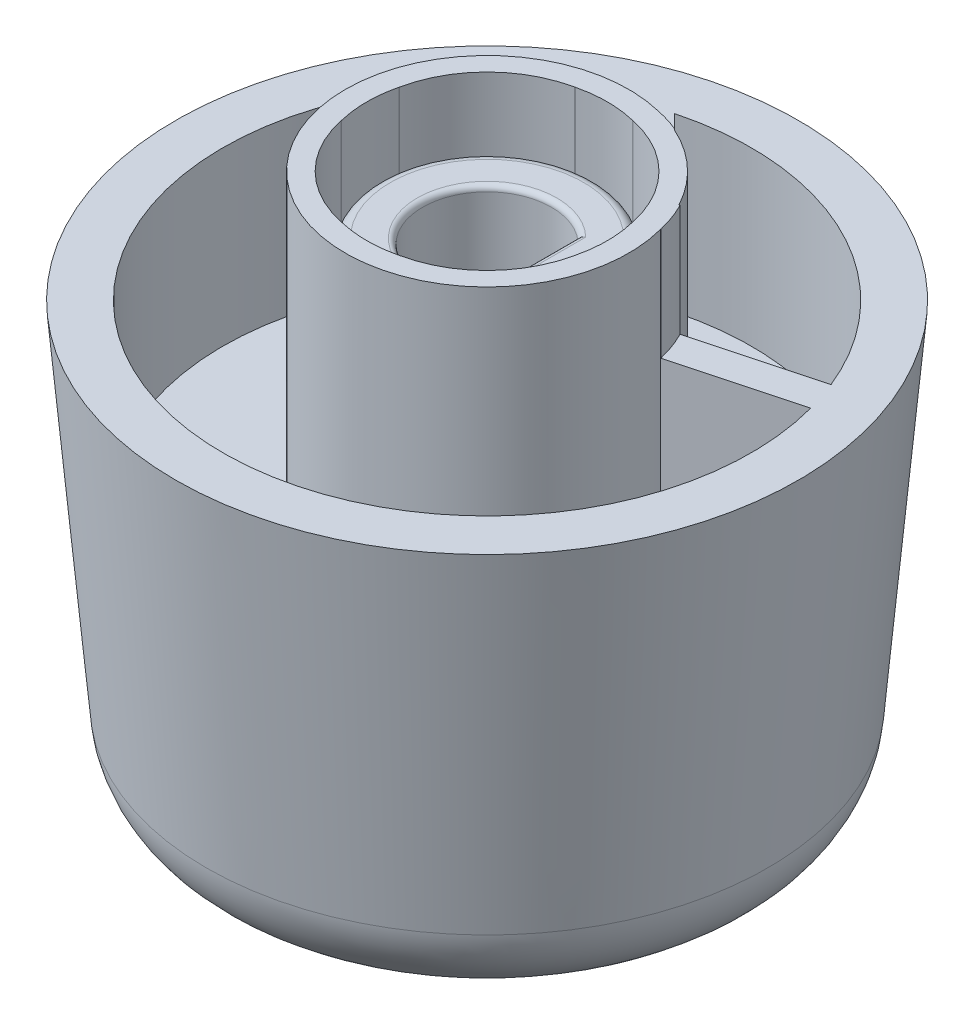
from build123d import *
from build123d.topology import SkipClean

# Parameters (mm, degrees)
SKETCH1_R             = 5
BOSS_EXTRUDE1_DEPTH   = 2.5
BOSS_EXTRUDE2_DEPTH   = 5.2
BOSS_EXTRUDE2_2_DEPTH = 5.2
BOSS_EXTRUDE2_3_DEPTH = 5.2
BOSS_EXTRUDE2_4_DEPTH = 5.2
FILLET1_R             = 0.5
FILLET2_R             = 0.5
FILLET3_R             = 0.5
FILLET4_R             = 0.5
SKETCH3_R             = 14.5
BOSS_EXTRUDE3_DEPTH   = 20
SKETCH4_OUTSIDE_W     = 44.126
SKETCH4_OUTSIDE_H     = 44.126
SKETCH4_OUTSIDE_R     = 14.5
CUT_EXTRUDE2_DEPTH    = 20
CUT_EXTRUDE2_DRAFT    = 5
FILLET5_R             = 4
CUT_EXTRUDE3_START    = -14
CUT_EXTRUDE3_DEPTH    = 14
FILLET6_R             = 0.25
FILLET7_R             = 0.5
CUT_EXTRUDE4_START    = -8
SKETCH6_R             = 12.3
SKETCH6_R_2           = 6.6
CUT_EXTRUDE4_DEPTH    = 8
BOSS_EXTRUDE4_DEPTH   = 8
BOSS_EXTRUDE5_DEPTH   = 5.2


# Read off the part's stored shape, not the designer's step: Boss-Extrude5
with BuildPart() as part:
    # Sketch1 → Boss-Extrude1 (new body)
    with BuildSketch(Plane(origin=(0, 0, 0), x_dir=(1, 0, 0), z_dir=(0, 1, 0))):
        with Locations(Location((0, 0, 0), (0, 0, 270))):
            Circle(SKETCH1_R)
        with BuildLine():
            Line((2, 2.236067977), (2, -2.236067977))
            ThreePointArc((2, -2.236067977), (-3, 0), (2, 2.236067977))
        make_face(mode=Mode.SUBTRACT)
    extrude(amount=BOSS_EXTRUDE1_DEPTH)



with BuildPart() as body_2:
    # Sketch2 → Boss-Extrude2 (new body)
    with BuildSketch(Plane.XZ):
        with BuildLine():
            Line((-6.305354867, 1.95), (-5.249523788, 1.95))
            ThreePointArc((-5.249523788, 1.95), (-5.6, 0), (-5.249523788, -1.95))
            Line((-5.249523788, -1.95), (-6.305354867, -1.95))
            ThreePointArc((-6.305354867, -1.95), (-6.6, 0), (-6.305354867, 1.95))
        make_face()
    extrude(amount=-BOSS_EXTRUDE2_DEPTH)

    # Fillet4
    fillet4_edges = [body_2.edges().sort_by_distance(p)[0] for p in [
        (-6.305354867, 2.6, 1.95),
        (-5.249523788, 2.6, -1.95),
        (-6.305354867, 2.6, -1.95),
        (-5.249523788, 2.6, 1.95),
    ]]
    fillet(fillet4_edges, radius=FILLET4_R - 0.0001)  # a hair under: the kernel refuses the full size


with BuildPart() as body_3:
    # Sketch2 → Boss-Extrude2 2 (new body)
    with BuildSketch(Plane.XZ):
        with BuildLine():
            Line((-1.95, 6.305354867), (-1.95, 5.249523788))
            ThreePointArc((-1.95, 5.249523788), (0, 5.6), (1.95, 5.249523788))
            Line((1.95, 5.249523788), (1.95, 6.305354867))
            ThreePointArc((1.95, 6.305354867), (0, 6.6), (-1.95, 6.305354867))
        make_face()
    extrude(amount=-BOSS_EXTRUDE2_2_DEPTH)

    # Fillet3
    fillet3_edges = [body_3.edges().sort_by_distance(p)[0] for p in [
        (-1.95, 2.6, 6.305354867),
        (-1.95, 2.6, 5.249523788),
        (1.95, 2.6, 6.305354867),
        (1.95, 2.6, 5.249523788),
    ]]
    fillet(fillet3_edges, radius=FILLET3_R - 0.0001)  # a hair under: the kernel refuses the full size


with BuildPart() as body_4:
    # Sketch2 → Boss-Extrude2 3 (new body)
    with BuildSketch(Plane.XZ):
        with BuildLine():
            Line((6.305354867, 1.95), (5.249523788, 1.95))
            ThreePointArc((5.249523788, 1.95), (5.6, 0), (5.249523788, -1.95))
            Line((5.249523788, -1.95), (6.305354867, -1.95))
            ThreePointArc((6.305354867, -1.95), (6.6, 0), (6.305354867, 1.95))
        make_face()
    extrude(amount=-BOSS_EXTRUDE2_3_DEPTH)

    # Fillet2
    fillet2_edges = [body_4.edges().sort_by_distance(p)[0] for p in [
        (6.305354867, 2.6, 1.95),
        (6.305354867, 2.6, -1.95),
        (5.249523788, 2.6, -1.95),
        (5.249523788, 2.6, 1.95),
    ]]
    fillet(fillet2_edges, radius=FILLET2_R - 0.0001)  # a hair under: the kernel refuses the full size


with BuildPart() as body_5:
    # Sketch2 → Boss-Extrude2 4 (new body)
    with BuildSketch(Plane.XZ):
        with BuildLine():
            Line((1.95, -6.305354867), (1.95, -5.249523788))
            ThreePointArc((1.95, -5.249523788), (0, -5.6), (-1.95, -5.249523788))
            Line((-1.95, -5.249523788), (-1.95, -6.305354867))
            ThreePointArc((-1.95, -6.305354867), (0, -6.6), (1.95, -6.305354867))
        make_face()
    extrude(amount=-BOSS_EXTRUDE2_4_DEPTH)

    # Fillet1
    fillet1_edges = [body_5.edges().sort_by_distance(p)[0] for p in [
        (1.95, 2.6, -6.305354867),
        (-1.95, 2.6, -6.305354867),
        (1.95, 2.6, -5.249523788),
        (-1.95, 2.6, -5.249523788),
    ]]
    fillet(fillet1_edges, radius=FILLET1_R - 0.0001)  # a hair under: the kernel refuses the full size


with BuildPart() as part_1:
    add(part.part)

    add(body_2.part)  # Boss-Extrude3 merges body 2

    add(body_3.part)  # Boss-Extrude3 merges body 3

    add(body_4.part)  # Boss-Extrude3 merges body 4

    add(body_5.part)  # Boss-Extrude3 merges body 5
    # Sketch3 → Boss-Extrude3 (add)
    with BuildSketch(Plane(origin=(0, 0, 0), x_dir=(1, 0, 0), z_dir=(0, 1, 0))):
        with Locations(Location((0, 0, 0), (0, 0, 270))):
            Circle(SKETCH3_R)
    extrude(amount=-BOSS_EXTRUDE3_DEPTH)


with BuildPart() as cut_extrude2_tool:
    # Sketch4 outside → Cut-Extrude2 (with draft: the straight prism first)
    with BuildSketch(Plane(origin=(0, 0, 0), x_dir=(1, 0, 0), z_dir=(0, 1, 0))):
        Rectangle(SKETCH4_OUTSIDE_W, SKETCH4_OUTSIDE_H)
        Circle(SKETCH4_OUTSIDE_R, mode=Mode.SUBTRACT)
    extrude(amount=-CUT_EXTRUDE2_DEPTH)
    # Cut-Extrude2: the draft: its side faces are tilted about the plane it starts from
    cut_extrude2_sides = [cut_extrude2_tool.faces().sort_by_distance(p)[0] for p in [
        (0, -10, 22.063),
        (22.063, -10, 0),
        (0, -10, -22.063),
        (-22.063, -10, 0),
        (-14.5, -10, 0),
    ]]
    draft(cut_extrude2_sides, Plane(origin=(0, 0, 0), x_dir=(1, 0, 0), z_dir=(0, 1, 0)), CUT_EXTRUDE2_DRAFT)


with BuildPart() as part_2:
    add(part_1.part)

    # Cut-Extrude2: cut by cut_extrude2_tool
    add(cut_extrude2_tool.part, mode=Mode.SUBTRACT)

    # Fillet5
    fillet5_edges = [part_2.edges().sort_by_distance(p)[0] for p in [
        (-12.750226729, -20, 0),
    ]]
    fillet(fillet5_edges, radius=FILLET5_R)

    # Sketch5 → Cut-Extrude3 (cut)
    with SkipClean():  # the faces are left unmerged after this step: merging them gives an invalid solid
        with BuildSketch(Plane(origin=(0, 0, 0), x_dir=(1, 0, 0), z_dir=(0, 1, 0)).offset(CUT_EXTRUDE3_START)):
            with BuildLine():
                Line((2, -2.236067977), (2, 2.236067977))
                ThreePointArc((2, 2.236067977), (-3, 0), (2, -2.236067977))
            make_face()
        extrude(amount=CUT_EXTRUDE3_DEPTH, mode=Mode.SUBTRACT)

    # Fillet6
    fillet6_edges = [part_2.edges().sort_by_distance(p)[0] for p in [
        (-3, 2.5, 0),
        (2, 2.5, 0),
    ]]
    fillet(fillet6_edges, radius=FILLET6_R)

    # Fillet7
    fillet7_edges = [part_2.edges().sort_by_distance(p)[0] for p in [
        (0, 2.5, -5),
    ]]
    fillet(fillet7_edges, radius=FILLET7_R)

    # Sketch6 → Cut-Extrude4 (cut)
    with SkipClean():  # the faces are left unmerged after this step: merging them gives an invalid solid
        with BuildSketch(Plane(origin=(0, 0, 0), x_dir=(1, 0, 0), z_dir=(0, 1, 0)).offset(CUT_EXTRUDE4_START)):
            with Locations(Location((0, 0, 0), (0, 0, 270))):
                Circle(SKETCH6_R)
            with Locations(Location((0, 0, 0), (0, 0, 76.248877743))):
                Circle(SKETCH6_R_2, mode=Mode.SUBTRACT)
        extrude(amount=CUT_EXTRUDE4_DEPTH, mode=Mode.SUBTRACT)

    # Sketch7 → Boss-Extrude4 (add)
    with SkipClean():  # the faces are left unmerged after this step: merging them gives an invalid solid
        with BuildSketch(Plane(origin=(0, -8, 0), x_dir=(1, 0, 0), z_dir=(0, 1, 0))):
            with BuildLine():
                Line((6.375110454, 1.708205698), (11.880887663, 3.183474255))
                ThreePointArc((11.880887663, 3.183474255), (11.664219973, 3.903328376), (11.40398128, 4.608601845))
                Line((11.40398128, 4.608601845), (5.820052572, 3.112392657))
                ThreePointArc((5.820052572, 3.112392657), (6.137868976, 2.426224317), (6.375110454, 1.708205698))
            make_face()
            with BuildLine():
                Line((2.697938648, 6.023381696), (-3.164606791, 11.885927135))
                ThreePointArc((-3.164606791, 11.885927135), (-3.964993354, 11.643402754), (-4.747049149, 11.347049149))
                Line((-4.747049149, 11.347049149), (0, 6.6))
                ThreePointArc((0, 6.6), (1.379434813, 6.454235787), (2.697938648, 6.023381696))
            make_face()
        extrude(amount=BOSS_EXTRUDE4_DEPTH)

    # Boss-Extrude5 outline → Boss-Extrude5 (add)
    with SkipClean():  # the faces are left unmerged after this step: merging them gives an invalid solid
        with BuildSketch(Plane(origin=(0, 0, 0), x_dir=(1, 0, 0), z_dir=(0, 1, 0))):
            with BuildLine():
                ThreePointArc((5.820052572, 3.112392657), (4.500834134, 4.827265489), (2.697938648, 6.023381696))
                Line((2.697938648, 6.023381696), (2.63830786, 6.083012483))
                ThreePointArc((2.63830786, 6.083012483), (2.110900212, 6.270800504), (1.568852459, 6.410826933))
                ThreePointArc((1.568852459, 6.410826933), (1.84333588, 6.233843964), (1.95, 5.925158226))
                ThreePointArc((1.95, 5.925158226), (1.772102461, 5.542731755), (1.36499998, 5.432436198))
                ThreePointArc((1.36499998, 5.432436198), (4.001957645, 4.001957645), (5.432436198, 1.36499998))
                ThreePointArc((5.432436198, 1.36499998), (5.542731755, 1.772102461), (5.925158226, 1.95))
                ThreePointArc((5.925158226, 1.95), (6.233843964, 1.84333588), (6.410826933, 1.568852459))
                ThreePointArc((6.410826933, 1.568852459), (6.393348383, 1.638626394), (6.375110454, 1.708205698))
                Line((6.375110454, 1.708205698), (6.379456664, 1.709370261))
                ThreePointArc((6.379456664, 1.709370261), (6.162816143, 2.431981568), (5.861013343, 3.123368063))
                Line((5.861013343, 3.123368063), (5.820052572, 3.112392657))
            make_face()
            with BuildLine():
                ThreePointArc((-1.95, 5.925158226), (-1.84333588, 6.233843964), (-1.568852459, 6.410826933))
                ThreePointArc((-1.568852459, 6.410826933), (-4.666904756, 4.666904756), (-6.410826932, 1.568852459))
                ThreePointArc((-6.410826932, 1.568852459), (-6.233843964, 1.84333588), (-5.925158226, 1.95))
                ThreePointArc((-5.925158226, 1.95), (-5.542731755, 1.772102461), (-5.432436198, 1.36499998))
                ThreePointArc((-5.432436198, 1.36499998), (-4.001957645, 4.001957645), (-1.36499998, 5.432436198))
                ThreePointArc((-1.36499998, 5.432436198), (-1.772102461, 5.542731755), (-1.95, 5.925158226))
            make_face()
            with BuildLine():
                ThreePointArc((-5.925158226, -1.95), (-6.233843964, -1.84333588), (-6.410826933, -1.568852459))
                ThreePointArc((-6.410826933, -1.568852459), (-4.666904756, -4.666904756), (-1.568852459, -6.410826933))
                ThreePointArc((-1.568852459, -6.410826933), (-1.84333588, -6.233843964), (-1.95, -5.925158226))
                ThreePointArc((-1.95, -5.925158226), (-1.772102461, -5.542731755), (-1.36499998, -5.432436198))
                ThreePointArc((-1.36499998, -5.432436198), (-4.001957645, -4.001957645), (-5.432436198, -1.36499998))
                ThreePointArc((-5.432436198, -1.36499998), (-5.542731755, -1.772102461), (-5.925158226, -1.95))
            make_face()
            with BuildLine():
                ThreePointArc((1.568852459, -6.410826933), (4.666904756, -4.666904756), (6.410826933, -1.568852459))
                ThreePointArc((6.410826933, -1.568852459), (6.233843964, -1.84333588), (5.925158226, -1.95))
                ThreePointArc((5.925158226, -1.95), (5.542731755, -1.772102461), (5.432436198, -1.36499998))
                ThreePointArc((5.432436198, -1.36499998), (4.001957645, -4.001957645), (1.36499998, -5.432436198))
                ThreePointArc((1.36499998, -5.432436198), (1.772102461, -5.542731755), (1.95, -5.925158226))
                ThreePointArc((1.95, -5.925158226), (1.84333588, -6.233843964), (1.568852459, -6.410826933))
            make_face()
        extrude(amount=BOSS_EXTRUDE5_DEPTH)


solid = part_2.part
